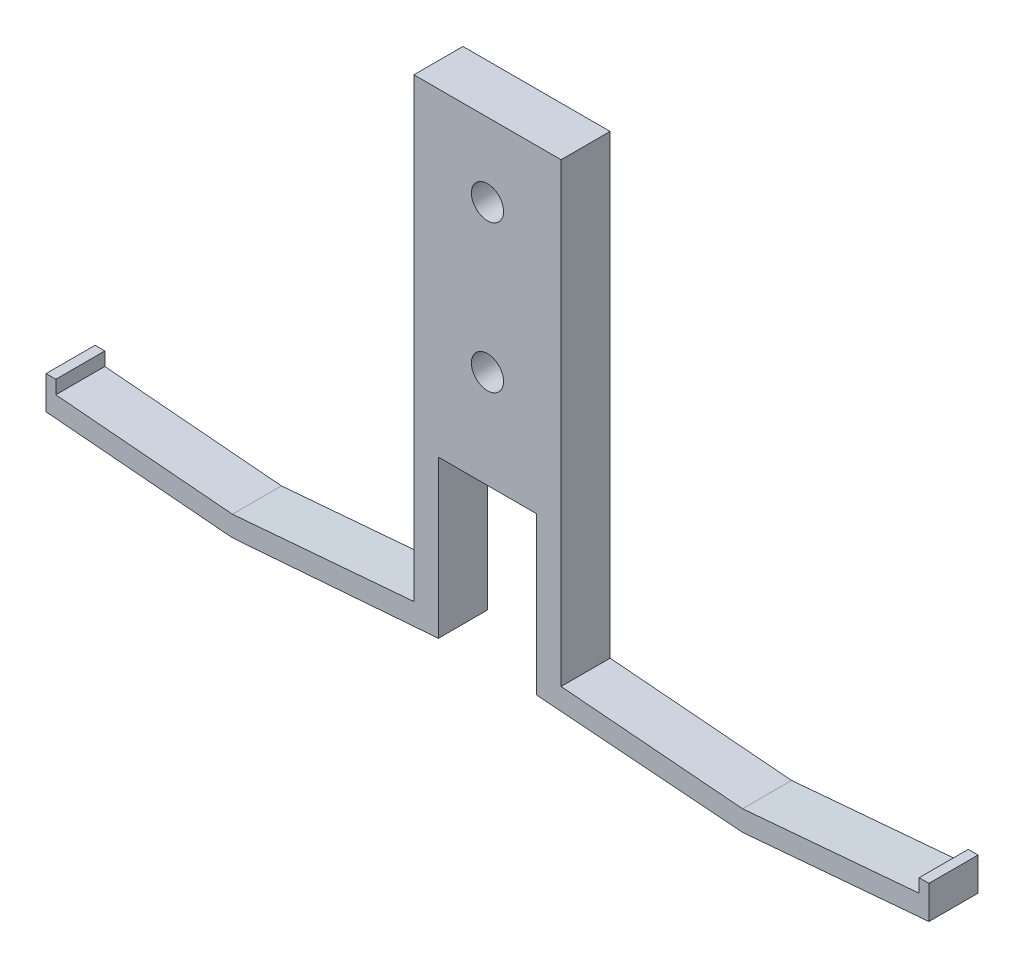
from build123d import *

# Parameters (mm, degrees)
BOSS_EXTRUDE1_DEPTH              = 12.7
F_21_64_0_32813_DIAMETER_HOLE1_D = 8.334502


with BuildPart() as part:
    # Sketch2 → Boss-Extrude1 (new body)
    with BuildSketch(Plane.XY):
        Polygon((12.7, 0), (12.7, -40.64), (66.04, -44.773379719), (114.3, -40.64), (114.3, -32.073379719), (111.76, -32.073379719), (111.76, -35.56), (66.04, -39.475833418), (19.05, -35.56), (19.05, 82.55), (-19.05, 82.55), (-19.05, -35.56), (-66.04, -39.475833418), (-111.76, -35.56), (-111.76, -32.073379719), (-114.3, -32.073379719), (-114.3, -40.64), (-66.04, -44.773379719), (-12.7, -40.64), (-12.7, 0), align=None)
    extrude(amount=BOSS_EXTRUDE1_DEPTH)

    # 21/64 (0.32813) Diameter Hole1 (through all)
    with Locations(Plane.XY.offset(12.7)):
        with Locations((0, 25.4), (0, 63.5)):
            Hole(F_21_64_0_32813_DIAMETER_HOLE1_D / 2)


solid = part.part
